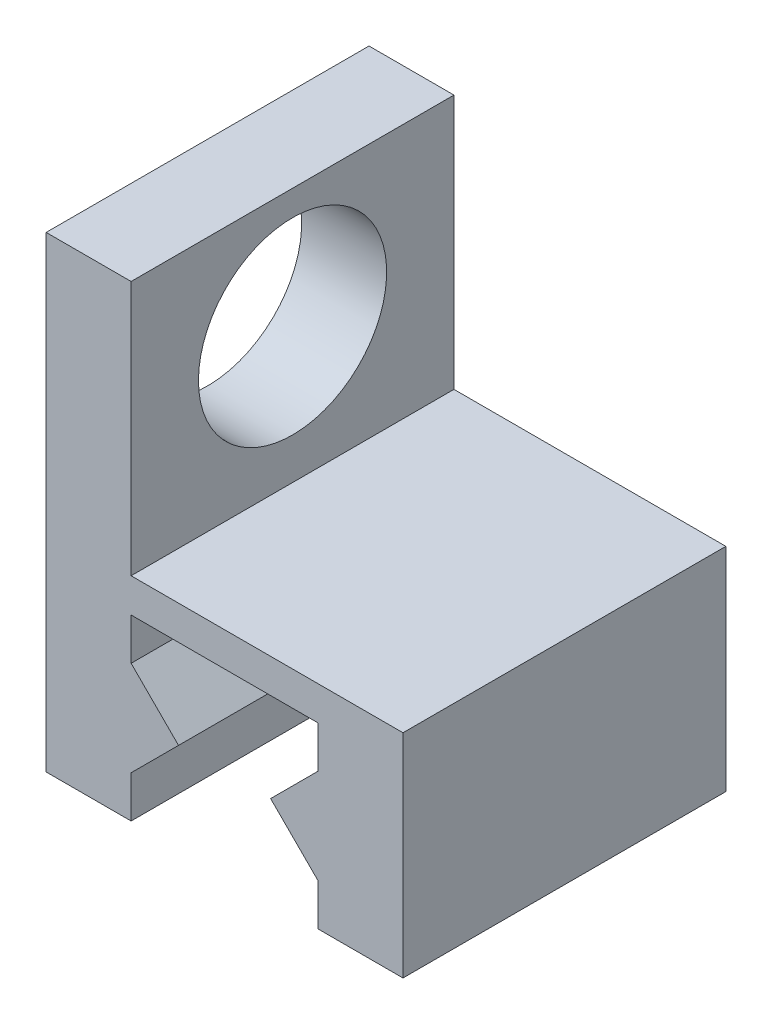
from build123d import *

# Parameters (mm, degrees)
BOSS_EXTRUDE1_DEPTH = 19
SKETCH2_W           = 10
SKETCH2_H           = 38
BOSS_EXTRUDE2_DEPTH = 30
CUT_EXTRUDE1_REACH  = 59.28
SKETCH3_R           = 11.075


with BuildPart() as part:
    # Sketch1 → Boss-Extrude1 (new, symmetric)
    with BuildSketch(Plane.XY):
        Polygon((-11, 0), (11, 0), (11, -4.92), (5.420001187, -10.499998813), (11, -16.079997627), (11, -20.999997627), (21, -20.999997627), (21, 4.000002373), (-21, 4.000002373), (-21, -20.999997627), (-11, -20.999997627), (-11, -16.079997627), (-5.420001187, -10.499998813), (-11, -4.92), align=None)
    extrude(amount=BOSS_EXTRUDE1_DEPTH, both=True)

    # Sketch2 → Boss-Extrude2 (add)
    with BuildSketch(Plane(origin=(0, 4.000002373, 0), x_dir=(1, 0, 0), z_dir=(0, 1, 0))):
        with Locations((-16, 0)):
            Rectangle(SKETCH2_W, SKETCH2_H)
    extrude(amount=BOSS_EXTRUDE2_DEPTH)

    # Sketch3 → Cut-Extrude1 (cut, up to next)
    with BuildSketch(Plane.ZY.offset(21), mode=Mode.PRIVATE) as cut_extrude1_sk1:
        with Locations((0, 19.925002373)):
            Circle(SKETCH3_R)
    cut_extrude1_tool1 = extrude(cut_extrude1_sk1.sketch, amount=-CUT_EXTRUDE1_REACH, mode=Mode.PRIVATE) & part.part
    add(cut_extrude1_tool1.solids().sort_by_distance((-21, 19.925002, 0))[0], mode=Mode.SUBTRACT)


solid = part.part
